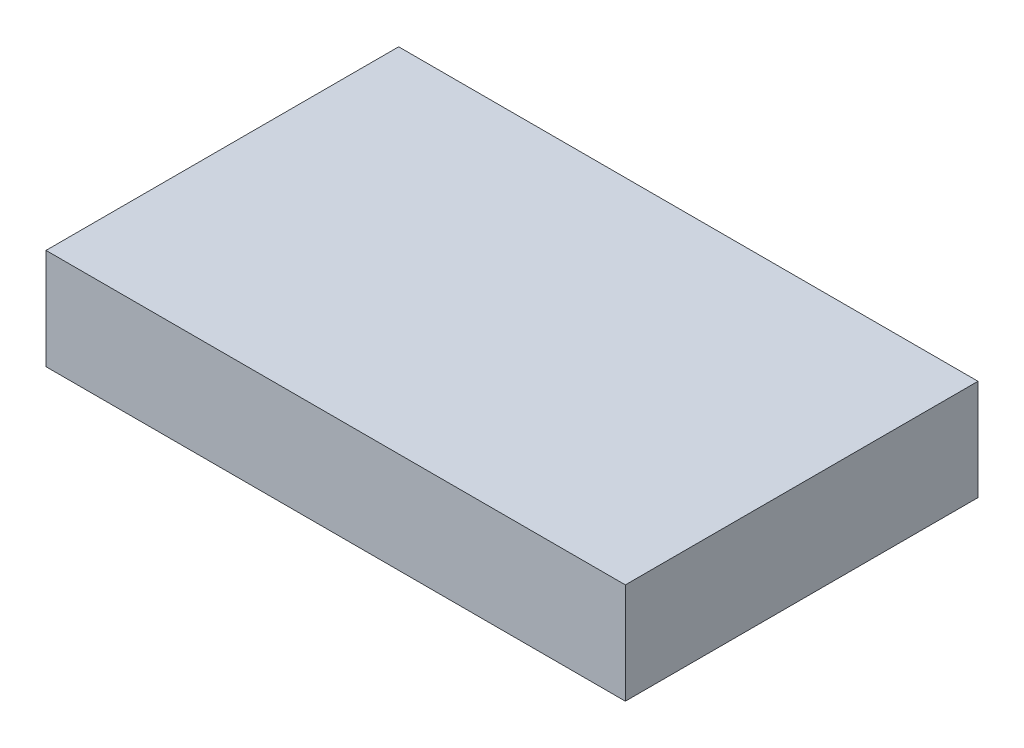
from build123d import *

# Parameters (mm, degrees)
SKETCH1_W           = 115
SKETCH1_H           = 70
BOSS_EXTRUDE1_DEPTH = 20


with BuildPart() as part:
    # Sketch1 → Boss-Extrude1 (new body)
    with BuildSketch(Plane(origin=(0, 0, 0), x_dir=(1, 0, 0), z_dir=(0, 1, 0))):
        Rectangle(SKETCH1_W, SKETCH1_H)
    extrude(amount=BOSS_EXTRUDE1_DEPTH)


solid = part.part
